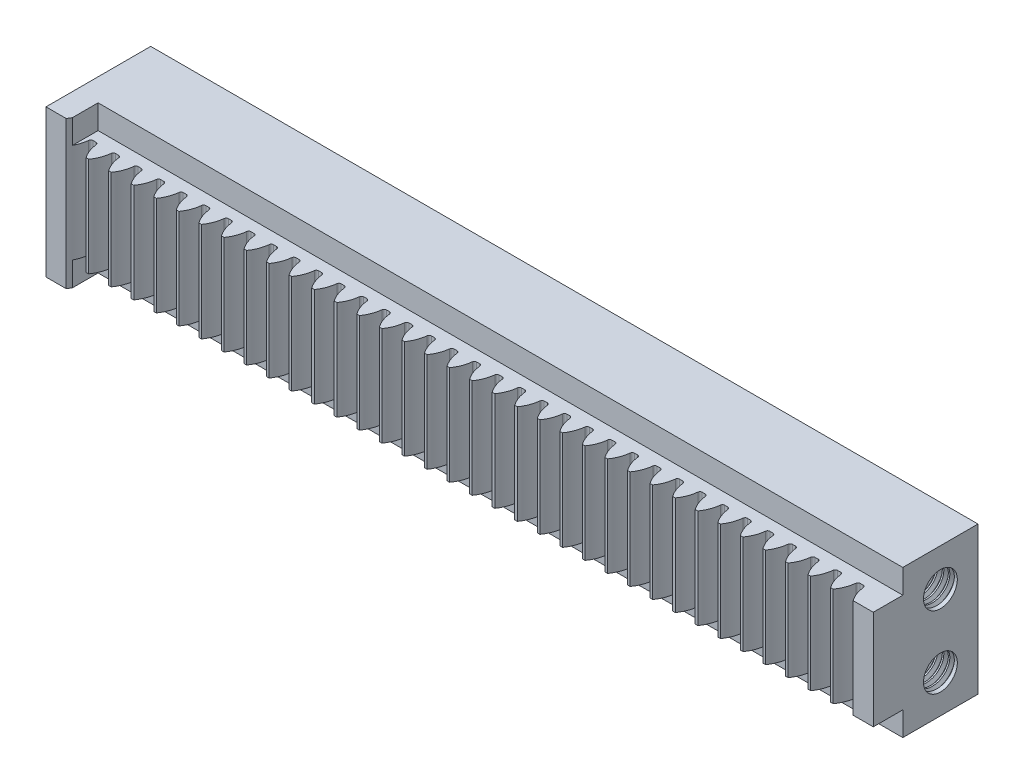
from build123d import *
from build123d.topology import SkipClean

# Parameters (mm, degrees)
SKIZZE8_W                       = 110
SKIZZE8_H                       = 13.925
AUFSATZ_LINEAR_AUSTRAGEN3_DEPTH = 19.6
SCHNITT_LINEAR_AUSTRAGEN1_DEPTH = 19.7
LINEARES_MUSTER1_COUNT          = 33
LINEARES_MUSTER1_PITCH          = 3
LINEARES_MUSTER2_COUNT          = 3
LINEARES_MUSTER2_PITCH          = 3
SKIZZE10_R                      = 2.25
SCHNITT_LINEAR_AUSTRAGEN2_DEPTH = 12
SKIZZE11_W                      = 3.925
SKIZZE11_H                      = 3.2
SCHNITT_LINEAR_AUSTRAGEN3_DEPTH = 107
GEWINDE1_PITCH                  = 0.8
GEWINDE2_PITCH                  = 0.8


with BuildPart() as part:
    # Skizze8 → Aufsatz-Linear austragen3 (new body)
    with BuildSketch(Plane(origin=(0, 0, 0), x_dir=(1, 0, 0), z_dir=(0, 1, 0))):
        with Locations((55, 6.9625)):
            Rectangle(SKIZZE8_W, SKIZZE8_H)
    extrude(amount=AUFSATZ_LINEAR_AUSTRAGEN3_DEPTH)

    # Skizze9 → Schnitt-Linear austragen1 (cut)
    with BuildSketch(Plane.XZ):
        with BuildLine():
            Line((9.79791179, -2.45), (10.20208821, -2.45))
            ThreePointArc((10.20208821, -2.45), (10.402930819, -2.372850279), (10.500473752, -2.181081644))
            ThreePointArc((10.500473752, -2.181081644), (10.995230767, -0.540156242), (12.060800205, 0.802223159))
            ThreePointArc((12.060800205, 0.802223159), (10, 0.920581665), (7.939199795, 0.802223159))
            ThreePointArc((7.939199795, 0.802223159), (9.004769233, -0.540156242), (9.499526248, -2.181081644))
            ThreePointArc((9.499526248, -2.181081644), (9.597069181, -2.372850279), (9.79791179, -2.45))
        make_face()
    schnitt_linear_austragen1 = extrude(amount=-SCHNITT_LINEAR_AUSTRAGEN1_DEPTH, mode=Mode.SUBTRACT)

    # Lineares Muster1: Schnitt-Linear austragen1 ×33
    with Locations(*[(i * LINEARES_MUSTER1_PITCH, 0, 0) for i in range(1, LINEARES_MUSTER1_COUNT)]):
        add(schnitt_linear_austragen1, mode=Mode.SUBTRACT)

    # Lineares Muster2: Schnitt-Linear austragen1 ×3
    with Locations(*[(-i * LINEARES_MUSTER2_PITCH, 0, 0) for i in range(1, LINEARES_MUSTER2_COUNT)]):
        add(schnitt_linear_austragen1, mode=Mode.SUBTRACT)

    # Skizze10 → Schnitt-Linear austragen2 (cut)
    with BuildSketch(Plane(origin=(110, 0, 0), x_dir=(0, 0, -1), z_dir=(1, 0, 0))):
        with Locations((8.925, 14.6)):
            Circle(SKIZZE10_R)
        with Locations((8.925, 5)):
            Circle(SKIZZE10_R)
    extrude(amount=-SCHNITT_LINEAR_AUSTRAGEN2_DEPTH, mode=Mode.SUBTRACT)

    # Skizze11 → Schnitt-Linear austragen3 (cut)
    with BuildSketch(Plane(origin=(110, 0, 0), x_dir=(0, 0, -1), z_dir=(1, 0, 0))):
        with Locations((1.9625, 18)):
            Rectangle(SKIZZE11_W, SKIZZE11_H)
        with Locations((1.9625, 1.6)):
            Rectangle(SKIZZE11_W, SKIZZE11_H)
    extrude(amount=-SCHNITT_LINEAR_AUSTRAGEN3_DEPTH, mode=Mode.SUBTRACT)

    # Gewinde1: the profile of Gewindeprofil1 profile screwed along a right-hand helix of 15 turns, 8 arcs to a turn; built about Z, then put on its axis
    with SkipClean():  # the faces are left unmerged after this step: merging them gives an invalid solid
        gewinde1_z = Axis((0, 0, 0), (0, 0, 1))
        gewinde1_corners = [(2.2497, 0, -0.000173205), (2.6830127, 0, 0.249999999), (2.6830127, 0, 0.349999999), (2.2497, 0, 0.600173203)]
        with BuildLine(mode=Mode.PRIVATE) as gewinde1_profile:
            Line(gewinde1_corners[0], gewinde1_corners[1])
            Line(gewinde1_corners[1], gewinde1_corners[2])
            Line(gewinde1_corners[2], gewinde1_corners[3])
            Line(gewinde1_corners[3], gewinde1_corners[0])
        gewinde1_cap = Face(gewinde1_profile.wire())
        gewinde1_turn_angles = [0, 22.5, 45, 67.5, 90, 112.5, 135, 157.5, 180, 202.5, 225, 247.5, 270, 292.5, 315, 337.5, 360]
        gewinde1_turn_weights = [1, 0.9238795325112867, 1, 0.9238795325112867, 1, 0.9238795325112867, 1, 0.9238795325112867, 1, 0.9238795325112867, 1, 0.9238795325112867, 1, 0.9238795325112867, 1, 0.9238795325112867, 1]
        gewinde1_turn_rails = [Edge.make_bspline([Vector(p[0], p[1], 0).rotate(gewinde1_z, gewinde1_turn_angles[k]) / gewinde1_turn_weights[k] + Vector(0, 0, p[2] + GEWINDE1_PITCH * gewinde1_turn_angles[k] / 360) for k in range(17)], [0, 0, 0, 1, 1, 2, 2, 3, 3, 4, 4, 5, 5, 6, 6, 7, 7, 8, 8, 8], 2, gewinde1_turn_weights) for p in gewinde1_corners]
        gewinde1_turn_sides = [Face.make_surface_from_curves(gewinde1_turn_rails[p[0]], gewinde1_turn_rails[p[1]]) for p in [(0, 1), (1, 2), (2, 3), (3, 0)]]
        gewinde1 = Plane(origin=(110, 5, -8.925), x_dir=(0, 0, 1), z_dir=(-1, 0, 0)) * Solid(Shell([*[p.moved(Location((0, 0, GEWINDE1_PITCH * i))) for i in range(15) for p in gewinde1_turn_sides], gewinde1_cap, gewinde1_cap.rotate(gewinde1_z, 5400).moved(Location((0, 0, GEWINDE1_PITCH * 5400 / 360)))]))
        add(gewinde1, mode=Mode.SUBTRACT)

    # Gewinde2: the profile of Gewindeprofil2 profile screwed along a right-hand helix of 15 turns, 8 arcs to a turn; built about Z, then put on its axis
    with SkipClean():  # the faces are left unmerged after this step: merging them gives an invalid solid
        gewinde2_z = Axis((0, 0, 0), (0, 0, 1))
        gewinde2_corners = [(2.2497, 0, -0.000173205), (2.6830127, 0, 0.249999999), (2.6830127, 0, 0.349999999), (2.2497, 0, 0.600173203)]
        with BuildLine(mode=Mode.PRIVATE) as gewinde2_profile:
            Line(gewinde2_corners[0], gewinde2_corners[1])
            Line(gewinde2_corners[1], gewinde2_corners[2])
            Line(gewinde2_corners[2], gewinde2_corners[3])
            Line(gewinde2_corners[3], gewinde2_corners[0])
        gewinde2_cap = Face(gewinde2_profile.wire())
        gewinde2_turn_angles = [0, 22.5, 45, 67.5, 90, 112.5, 135, 157.5, 180, 202.5, 225, 247.5, 270, 292.5, 315, 337.5, 360]
        gewinde2_turn_weights = [1, 0.9238795325112867, 1, 0.9238795325112867, 1, 0.9238795325112867, 1, 0.9238795325112867, 1, 0.9238795325112867, 1, 0.9238795325112867, 1, 0.9238795325112867, 1, 0.9238795325112867, 1]
        gewinde2_turn_rails = [Edge.make_bspline([Vector(p[0], p[1], 0).rotate(gewinde2_z, gewinde2_turn_angles[k]) / gewinde2_turn_weights[k] + Vector(0, 0, p[2] + GEWINDE2_PITCH * gewinde2_turn_angles[k] / 360) for k in range(17)], [0, 0, 0, 1, 1, 2, 2, 3, 3, 4, 4, 5, 5, 6, 6, 7, 7, 8, 8, 8], 2, gewinde2_turn_weights) for p in gewinde2_corners]
        gewinde2_turn_sides = [Face.make_surface_from_curves(gewinde2_turn_rails[p[0]], gewinde2_turn_rails[p[1]]) for p in [(0, 1), (1, 2), (2, 3), (3, 0)]]
        gewinde2 = Plane(origin=(110, 14.6, -8.925), x_dir=(0, 0, 1), z_dir=(-1, 0, 0)) * Solid(Shell([*[p.moved(Location((0, 0, GEWINDE2_PITCH * i))) for i in range(15) for p in gewinde2_turn_sides], gewinde2_cap, gewinde2_cap.rotate(gewinde2_z, 5400).moved(Location((0, 0, GEWINDE2_PITCH * 5400 / 360)))]))
        add(gewinde2, mode=Mode.SUBTRACT)


solid = part.part
